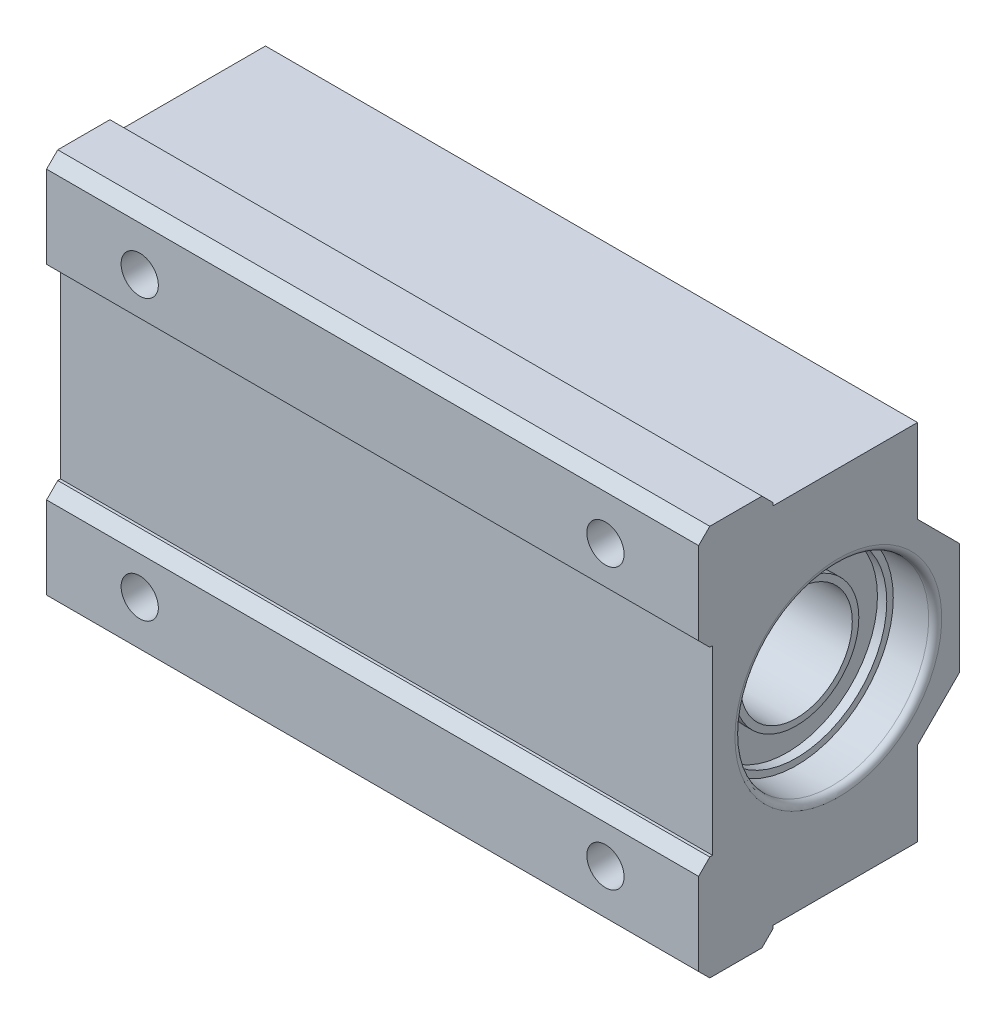
from build123d import *

# Parameters (mm, degrees)
CROQUIS1_W              = 70
CROQUIS1_H              = 42
SALIENTE_EXTRUIR1_DEPTH = 28
CROQUIS2_W              = 1.5
CROQUIS2_H              = 19.5
CORTAR_EXTRUIR1_DEPTH   = 70
CROQUIS3_R              = 2
CORTAR_EXTRUIR2_DEPTH   = 70
CROQUIS4_R              = 6
CORTAR_EXTRUIR3_DEPTH   = 70
CROQUIS5_R              = 10.4
CORTAR_EXTRUIR4_DEPTH   = 4.5
CROQUIS6_R              = 9.7
CROQUIS6_R_2            = 6.7
CORTAR_EXTRUIR5_DEPTH   = 1
CHAFL_N1_SIZE           = 1.2
REDONDEO1_R             = 0.7


with BuildPart() as part:
    # Croquis1 → Saliente-Extruir1 (new body)
    with BuildSketch(Plane.XY):
        Rectangle(CROQUIS1_W, CROQUIS1_H)
    extrude(amount=SALIENTE_EXTRUIR1_DEPTH)

    # Croquis2 → Cortar-Extruir1 (cut)
    with BuildSketch(Plane(origin=(35, 0, 0), x_dir=(0, 0, -1), z_dir=(1, 0, 0))):
        with Locations((-27.25, 0)):
            Rectangle(CROQUIS2_W, CROQUIS2_H)
        Polygon((0, 21), (-20, 21), (-20, 19.5), (-4.5, 19.5), (-4.5, 10.5), (0, 6), align=None)
        Polygon((-20, -19.5), (-20, -21), (0, -21), (0, -6), (-4.5, -10.5), (-4.5, -19.5), align=None)
    extrude(amount=-CORTAR_EXTRUIR1_DEPTH, mode=Mode.SUBTRACT)

    # Croquis3 → Cortar-Extruir2 (cut)
    with BuildSketch(Plane.XY.offset(28)):
        with Locations((25, -15)):
            Circle(CROQUIS3_R)
        with Locations((-25, -15)):
            Circle(CROQUIS3_R)
        with Locations((-25, 15)):
            Circle(CROQUIS3_R)
        with Locations((25, 15)):
            Circle(CROQUIS3_R)
    extrude(amount=-CORTAR_EXTRUIR2_DEPTH, mode=Mode.SUBTRACT)

    # Croquis4 → Cortar-Extruir3 (cut)
    with BuildSketch(Plane(origin=(35, 0, 0), x_dir=(0, 0, -1), z_dir=(1, 0, 0))):
        with Locations((-13, 0)):
            Circle(CROQUIS4_R)
    extrude(amount=-CORTAR_EXTRUIR3_DEPTH, mode=Mode.SUBTRACT)

    # Croquis5 → Cortar-Extruir4 (cut)
    with BuildSketch(Plane(origin=(35, 0, 0), x_dir=(0, 0, -1), z_dir=(1, 0, 0))):
        with Locations((-13, 0)):
            Circle(CROQUIS5_R)
    cortar_extruir4 = extrude(amount=-CORTAR_EXTRUIR4_DEPTH, mode=Mode.SUBTRACT)

    # Croquis6 → Cortar-Extruir5 (cut)
    with BuildSketch(Plane(origin=(30.5, 0, 0), x_dir=(0, 0, -1), z_dir=(1, 0, 0))):
        with Locations((-13, 0)):
            Circle(CROQUIS6_R)
        with Locations((-13, 0)):
            Circle(CROQUIS6_R_2, mode=Mode.SUBTRACT)
    cortar_extruir5 = extrude(amount=-CORTAR_EXTRUIR5_DEPTH, mode=Mode.SUBTRACT)

    # Simetría1: Cortar-Extruir4, Cortar-Extruir5 across plane
    add(cortar_extruir4.mirror(Plane(origin=(0, 0, 0), x_dir=(0, 0, 1), z_dir=(1, 0, 0))), mode=Mode.SUBTRACT)
    add(cortar_extruir5.mirror(Plane(origin=(0, 0, 0), x_dir=(0, 0, 1), z_dir=(1, 0, 0))), mode=Mode.SUBTRACT)

    # Chaflán1
    chafl_n1_edges = [part.edges().sort_by_distance(p)[0] for p in [
        (0, -21, 20),
        (0, 21, 20),
        (0, 21, 28),
        (0, -21, 28),
        (0, 9.75, 28),
        (0, -9.75, 28),
    ]]
    chamfer(chafl_n1_edges, length=CHAFL_N1_SIZE)

    # Redondeo1
    redondeo1_edges = [part.edges().sort_by_distance(p)[0] for p in [
        (35, 0, 23.4),
        (-35, 0, 23.4),
    ]]
    fillet(redondeo1_edges, radius=REDONDEO1_R)


solid = part.part
